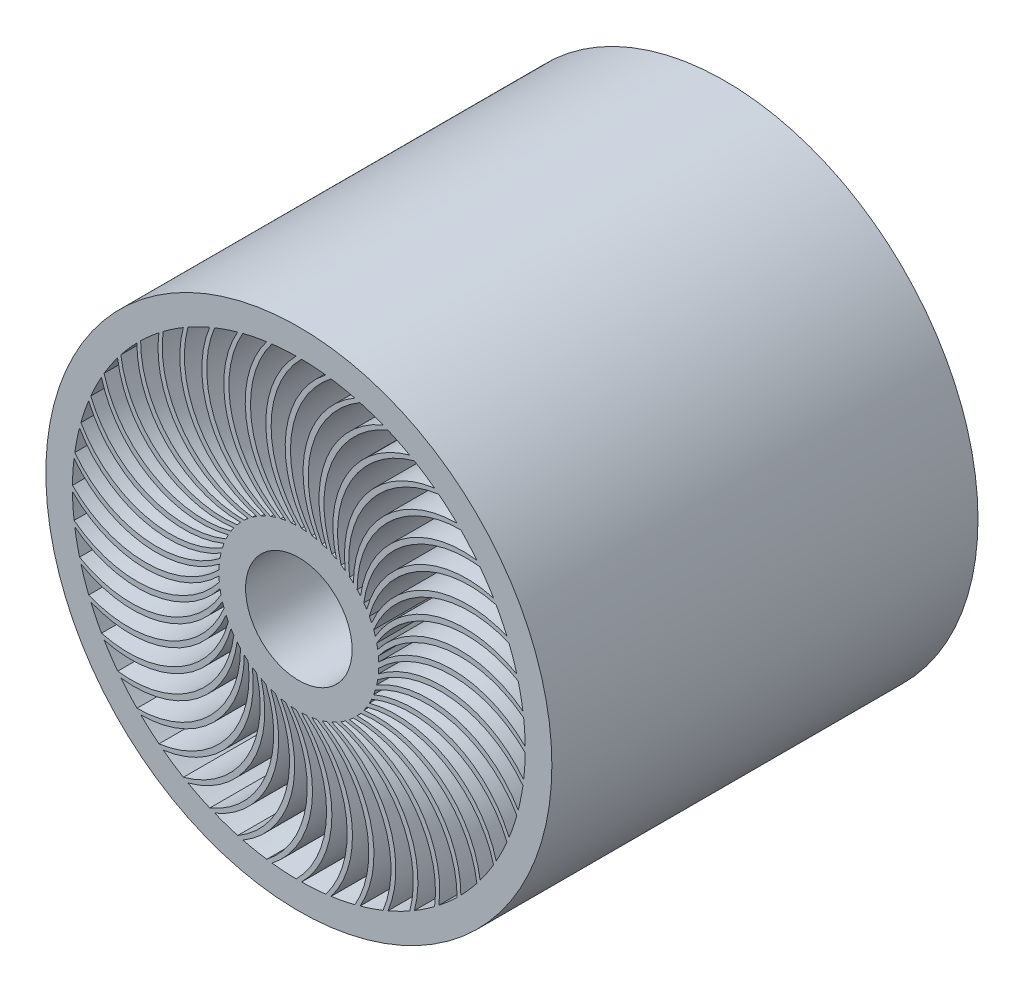
from build123d import *

# Parameters (mm, degrees)
SKETCH1_R           = 120.65
SKETCH1_R_2         = 25.4
BOSS_EXTRUDE2_DEPTH = 203.2


with BuildPart() as part:
    # Sketch1 → Boss-Extrude2 (new body)
    with BuildSketch(Plane.XY):
        Circle(SKETCH1_R)
        with BuildLine():
            ThreePointArc((1.239671441, 107.942881723), (7.029570809, 107.720878358), (12.799218379, 107.188537208))
            ThreePointArc((12.799218379, 107.188537208), (-6.095938305, 74.436927794), (3.709061895, 37.919030313))
            ThreePointArc((3.709061895, 37.919030313), (2.489766262, 38.018562098), (1.267903716, 38.078897308))
            ThreePointArc((1.267903716, 38.078897308), (-13.219615705, 73.005040764), (1.239671441, 107.942881723))
        make_face(mode=Mode.SUBTRACT)
        with BuildLine():
            ThreePointArc((-1.30119232, 107.942157652), (-15.759755454, 73.004429943), (-1.272096284, 38.078757478))
            ThreePointArc((-1.272096284, 38.078757478), (-2.493952178, 38.018287738), (-3.713236845, 37.918621707))
            ThreePointArc((-3.713236845, 37.918621707), (-22.635590043, 70.654966419), (-12.860307449, 107.181224999))
            ThreePointArc((-12.860307449, 107.181224999), (-7.090964218, 107.716854421), (-1.30119232, 107.942157652))
        make_face(mode=Mode.SUBTRACT)
        Circle(SKETCH1_R_2, mode=Mode.SUBTRACT)
        with BuildLine():
            ThreePointArc((8.626756995, 37.110498026), (7.43088411, 37.368328319), (6.227350094, 37.587632418))
            ThreePointArc((6.227350094, 37.587632418), (-3.577450076, 74.10597862), (15.318439209, 106.857605814))
            ThreePointArc((15.318439209, 106.857605814), (21.029827931, 105.8817682), (26.680630903, 104.600891175))
            ThreePointArc((26.680630903, 104.600891175), (3.672182037, 74.595789173), (8.626756995, 37.110498026))
        make_face(mode=Mode.SUBTRACT)
        with BuildLine():
            ThreePointArc((13.396845892, 35.666994829), (12.244857472, 36.078712082), (11.080244785, 36.453232717))
            ThreePointArc((11.080244785, 36.453232717), (6.125926715, 73.938942636), (29.135104234, 103.943966642))
            ThreePointArc((29.135104234, 103.943966642), (34.670258866, 102.230991632), (40.105530435, 100.223494893))
            ThreePointArc((40.105530435, 100.223494893), (13.377470327, 73.478295917), (13.396845892, 35.666994829))
        make_face(mode=Mode.SUBTRACT)
        with BuildLine():
            ThreePointArc((17.937711041, 33.613219462), (16.849317927, 34.171779079), (15.743553415, 34.695108097))
            ThreePointArc((15.743553415, 34.695108097), (15.724487202, 72.506790844), (42.453259549, 99.251817382))
            ThreePointArc((42.453259549, 99.251817382), (47.71747206, 96.831014454), (52.844213222, 94.131246826))
            ThreePointArc((52.844213222, 94.131246826), (22.853866391, 71.103568646), (17.937711041, 33.613219462))
        make_face(mode=Mode.SUBTRACT)
        with BuildLine():
            ThreePointArc((22.171656981, 30.98431259), (21.165481881, 31.680157461), (20.137485482, 32.343340558))
            ThreePointArc((20.137485482, 32.343340558), (25.053997353, 69.834027758), (55.045027822, 92.861442009))
            ThreePointArc((55.045027822, 92.861442009), (59.948226077, 89.774231772), (64.678716869, 86.428387027))
            ThreePointArc((64.678716869, 86.428387027), (31.939226465, 67.512239602), (22.171656981, 30.984312591))
        make_face(mode=Mode.SUBTRACT)
        with BuildLine():
            ThreePointArc((26.026239723, 27.82525554), (25.119498571, 28.646479566), (24.186859589, 29.438169495))
            ThreePointArc((24.186859589, 29.438169495), (33.954826663, 65.966385095), (66.694960408, 84.882181618))
            ThreePointArc((66.694960408, 84.882181618), (71.153249325, 81.181387094), (75.406549739, 77.246713565))
            ThreePointArc((75.406549739, 77.246713565), (40.478097518, 62.76575742), (26.026239723, 27.82525554))
        make_face(mode=Mode.SUBTRACT)
        with BuildLine():
            ThreePointArc((29.435506288, 24.190100653), (28.643713677, 25.122652463), (27.822389822, 26.029303191))
            ThreePointArc((27.822389822, 26.029303191), (42.274679475, 60.970039294), (77.20372373, 75.450563565))
            ThreePointArc((77.20372373, 75.450563565), (81.14082075, 71.199506375), (84.844155635, 66.743327416))
            ThreePointArc((84.844155635, 66.743327416), (48.3243771, 56.945335727), (29.435506288, 24.190100653))
        make_face(mode=Mode.SUBTRACT)
        with BuildLine():
            ThreePointArc((32.341123178, 20.141046436), (31.6778269, 21.168969811), (30.981871252, 22.175068291))
            ThreePointArc((30.981871252, 22.175068291), (49.871200801, 54.930479217), (86.391509934, 64.727965451))
            ThreePointArc((86.391509934, 64.727965451), (89.740050235, 59.999382361), (92.830054506, 55.09794443))
            ThreePointArc((92.830054506, 55.09794443), (55.343813192, 50.150563552), (32.341123178, 20.141046436))
        make_face(mode=Mode.SUBTRACT)
        with BuildLine():
            ThreePointArc((34.693374485, 15.747373332), (34.169923723, 16.853080217), (33.611244275, 17.941411826))
            ThreePointArc((33.611244275, 17.941411826), (56.614412053, 47.95104341), (94.101113451, 52.897853901))
            ThreePointArc((94.101113451, 52.897853901), (96.803802581, 47.772652281), (99.227605407, 42.509820339))
            ThreePointArc((99.227605407, 42.509820339), (61.416301297, 42.497701329), (34.693374485, 15.747373332))
        make_face(mode=Mode.SUBTRACT)
        with BuildLine():
            ThreePointArc((36.452012535, 11.084258303), (36.077363676, 12.248829747), (35.665519589, 13.40077283))
            ThreePointArc((35.665519589, 13.40077283), (62.388935019, 40.151151957), (100.200620826, 40.162645406))
            ThreePointArc((100.200620826, 40.162645406), (102.211215024, 34.728518875), (103.927344468, 29.194341436))
            ThreePointArc((103.927344468, 29.194341436), (66.437939458, 34.117691655), (36.452012535, 11.084258303))
        make_face(mode=Mode.SUBTRACT)
        with BuildLine():
            ThreePointArc((37.586946545, 6.231488542), (37.367509935, 7.434998405), (37.109547975, 8.630842895))
            ThreePointArc((37.109547975, 8.630842895), (67.09596601, 31.664263161), (104.585667799, 26.740242912))
            ThreePointArc((104.585667799, 26.740242912), (105.869765241, 21.090170882), (106.848857851, 15.379339257))
            ThreePointArc((106.848857851, 15.379339257), (70.322806055, 25.153918817), (37.586946545, 6.231488542))
        make_face(mode=Mode.SUBTRACT)
        with BuildLine():
            ThreePointArc((38.078757478, 1.272096284), (38.018287738, 2.493952178), (37.918621707, 3.713236845))
            ThreePointArc((37.918621707, 3.713236845), (70.654966419, 22.635590043), (107.181224999, 12.860307449))
            ThreePointArc((107.181224999, 12.860307449), (107.716854421, 7.090964218), (107.942157652, 1.30119232))
            ThreePointArc((107.942157652, 1.30119232), (73.004429943, 15.759755454), (38.078757478, 1.272096284))
        make_face(mode=Mode.SUBTRACT)
        with BuildLine():
            ThreePointArc((37.919030313, -3.709061895), (38.018562098, -2.489766262), (38.078897308, -1.267903716))
            ThreePointArc((38.078897308, -1.267903716), (73.005040764, 13.219615705), (107.942881723, -1.239671441))
            ThreePointArc((107.942881723, -1.239671441), (107.720878358, -7.029570809), (107.188537208, -12.799218379))
            ThreePointArc((107.188537208, -12.799218379), (74.436927794, 6.095938305), (37.919030313, -3.709061895))
        make_face(mode=Mode.SUBTRACT)
        with BuildLine():
            ThreePointArc((37.110498026, -8.626756995), (37.368328319, -7.43088411), (37.587632418, -6.227350094))
            ThreePointArc((37.587632418, -6.227350094), (74.10597862, 3.577450076), (106.857605814, -15.318439209))
            ThreePointArc((106.857605814, -15.318439209), (105.8817682, -21.029827931), (104.600891175, -26.680630903))
            ThreePointArc((104.600891175, -26.680630903), (74.595789173, -3.672182037), (37.110498026, -8.626756995))
        make_face(mode=Mode.SUBTRACT)
        with BuildLine():
            ThreePointArc((35.666994829, -13.396845892), (36.078712082, -12.244857472), (36.453232717, -11.080244785))
            ThreePointArc((36.453232717, -11.080244785), (73.938942636, -6.125926715), (103.943966642, -29.135104234))
            ThreePointArc((103.943966642, -29.135104234), (102.230991632, -34.670258866), (100.223494893, -40.105530435))
            ThreePointArc((100.223494893, -40.105530435), (73.478295917, -13.377470327), (35.666994829, -13.396845892))
        make_face(mode=Mode.SUBTRACT)
        with BuildLine():
            ThreePointArc((33.613219462, -17.937711041), (34.171779079, -16.849317927), (34.695108097, -15.743553415))
            ThreePointArc((34.695108097, -15.743553415), (72.506790844, -15.724487202), (99.251817382, -42.453259549))
            ThreePointArc((99.251817382, -42.453259549), (96.831014454, -47.71747206), (94.131246826, -52.844213222))
            ThreePointArc((94.131246826, -52.844213222), (71.103568646, -22.853866391), (33.613219462, -17.937711041))
        make_face(mode=Mode.SUBTRACT)
        with BuildLine():
            ThreePointArc((30.984312591, -22.171656981), (31.680157461, -21.165481881), (32.343340558, -20.137485482))
            ThreePointArc((32.343340558, -20.137485482), (69.834027758, -25.053997353), (92.861442009, -55.045027822))
            ThreePointArc((92.861442009, -55.045027822), (89.774231772, -59.948226077), (86.428387027, -64.678716869))
            ThreePointArc((86.428387027, -64.678716869), (67.512239602, -31.939226465), (30.984312591, -22.171656981))
        make_face(mode=Mode.SUBTRACT)
        with BuildLine():
            ThreePointArc((27.82525554, -26.026239723), (28.646479566, -25.119498571), (29.438169495, -24.186859589))
            ThreePointArc((29.438169495, -24.186859589), (65.966385095, -33.954826663), (84.882181618, -66.694960408))
            ThreePointArc((84.882181618, -66.694960408), (81.181387094, -71.153249325), (77.246713565, -75.406549739))
            ThreePointArc((77.246713565, -75.406549739), (62.76575742, -40.478097518), (27.82525554, -26.026239723))
        make_face(mode=Mode.SUBTRACT)
        with BuildLine():
            ThreePointArc((24.190100653, -29.435506288), (25.122652463, -28.643713677), (26.029303191, -27.822389822))
            ThreePointArc((26.029303191, -27.822389822), (60.970039294, -42.274679475), (75.450563565, -77.20372373))
            ThreePointArc((75.450563565, -77.20372373), (71.199506375, -81.14082075), (66.743327416, -84.844155635))
            ThreePointArc((66.743327416, -84.844155635), (56.945335727, -48.3243771), (24.190100653, -29.435506288))
        make_face(mode=Mode.SUBTRACT)
        with BuildLine():
            ThreePointArc((20.141046436, -32.341123178), (21.168969811, -31.6778269), (22.175068291, -30.981871252))
            ThreePointArc((22.175068291, -30.981871252), (54.930479217, -49.871200801), (64.727965451, -86.391509934))
            ThreePointArc((64.727965451, -86.391509934), (59.999382361, -89.740050235), (55.09794443, -92.830054506))
            ThreePointArc((55.09794443, -92.830054506), (50.150563552, -55.343813192), (20.141046436, -32.341123178))
        make_face(mode=Mode.SUBTRACT)
        with BuildLine():
            ThreePointArc((15.747373332, -34.693374485), (16.853080217, -34.169923723), (17.941411826, -33.611244275))
            ThreePointArc((17.941411826, -33.611244275), (47.95104341, -56.614412053), (52.897853901, -94.101113451))
            ThreePointArc((52.897853901, -94.101113451), (47.772652281, -96.803802581), (42.509820339, -99.227605407))
            ThreePointArc((42.509820339, -99.227605407), (42.497701329, -61.416301297), (15.747373332, -34.693374485))
        make_face(mode=Mode.SUBTRACT)
        with BuildLine():
            ThreePointArc((11.084258303, -36.452012535), (12.248829747, -36.077363676), (13.40077283, -35.665519589))
            ThreePointArc((13.40077283, -35.665519589), (40.151151957, -62.388935019), (40.162645406, -100.200620826))
            ThreePointArc((40.162645406, -100.200620826), (34.728518875, -102.211215024), (29.194341436, -103.927344468))
            ThreePointArc((29.194341436, -103.927344468), (34.117691655, -66.437939458), (11.084258303, -36.452012535))
        make_face(mode=Mode.SUBTRACT)
        with BuildLine():
            ThreePointArc((6.231488542, -37.586946545), (7.434998405, -37.367509935), (8.630842895, -37.109547975))
            ThreePointArc((8.630842895, -37.109547975), (31.664263161, -67.09596601), (26.740242912, -104.585667799))
            ThreePointArc((26.740242912, -104.585667799), (21.090170882, -105.869765241), (15.379339257, -106.848857851))
            ThreePointArc((15.379339257, -106.848857851), (25.153918817, -70.322806055), (6.231488542, -37.586946545))
        make_face(mode=Mode.SUBTRACT)
        with BuildLine():
            ThreePointArc((1.272096284, -38.078757478), (2.493952178, -38.018287738), (3.713236845, -37.918621707))
            ThreePointArc((3.713236845, -37.918621707), (22.635590043, -70.654966419), (12.860307449, -107.181224999))
            ThreePointArc((12.860307449, -107.181224999), (7.090964218, -107.716854421), (1.30119232, -107.942157652))
            ThreePointArc((1.30119232, -107.942157652), (15.759755454, -73.004429943), (1.272096284, -38.078757478))
        make_face(mode=Mode.SUBTRACT)
        with BuildLine():
            ThreePointArc((-3.709061894, -37.919030313), (-2.489766262, -38.018562098), (-1.267903716, -38.078897308))
            ThreePointArc((-1.267903716, -38.078897308), (13.219615705, -73.005040764), (-1.239671441, -107.942881723))
            ThreePointArc((-1.239671441, -107.942881723), (-7.029570809, -107.720878358), (-12.799218379, -107.188537208))
            ThreePointArc((-12.799218379, -107.188537208), (6.095938305, -74.436927794), (-3.709061894, -37.919030313))
        make_face(mode=Mode.SUBTRACT)
        with BuildLine():
            ThreePointArc((-8.626756995, -37.110498026), (-7.43088411, -37.368328319), (-6.227350094, -37.587632418))
            ThreePointArc((-6.227350094, -37.587632418), (3.577450076, -74.10597862), (-15.318439209, -106.857605814))
            ThreePointArc((-15.318439209, -106.857605814), (-21.029827931, -105.8817682), (-26.680630903, -104.600891175))
            ThreePointArc((-26.680630903, -104.600891175), (-3.672182037, -74.595789173), (-8.626756995, -37.110498026))
        make_face(mode=Mode.SUBTRACT)
        with BuildLine():
            ThreePointArc((-13.396845892, -35.666994829), (-12.244857472, -36.078712082), (-11.080244785, -36.453232717))
            ThreePointArc((-11.080244785, -36.453232717), (-6.125926715, -73.938942636), (-29.135104234, -103.943966642))
            ThreePointArc((-29.135104234, -103.943966642), (-34.670258866, -102.230991632), (-40.105530435, -100.223494893))
            ThreePointArc((-40.105530435, -100.223494893), (-13.377470327, -73.478295917), (-13.396845892, -35.666994829))
        make_face(mode=Mode.SUBTRACT)
        with BuildLine():
            ThreePointArc((-17.937711041, -33.613219462), (-16.849317927, -34.171779079), (-15.743553415, -34.695108097))
            ThreePointArc((-15.743553415, -34.695108097), (-15.724487202, -72.506790844), (-42.453259549, -99.251817382))
            ThreePointArc((-42.453259549, -99.251817382), (-47.71747206, -96.831014454), (-52.844213222, -94.131246826))
            ThreePointArc((-52.844213222, -94.131246826), (-22.853866391, -71.103568646), (-17.937711041, -33.613219462))
        make_face(mode=Mode.SUBTRACT)
        with BuildLine():
            ThreePointArc((-22.171656981, -30.984312591), (-21.165481881, -31.680157461), (-20.137485482, -32.343340558))
            ThreePointArc((-20.137485482, -32.343340558), (-25.053997353, -69.834027758), (-55.045027822, -92.861442009))
            ThreePointArc((-55.045027822, -92.861442009), (-59.948226077, -89.774231772), (-64.678716869, -86.428387027))
            ThreePointArc((-64.678716869, -86.428387027), (-31.939226465, -67.512239602), (-22.171656981, -30.984312591))
        make_face(mode=Mode.SUBTRACT)
        with BuildLine():
            ThreePointArc((-26.026239723, -27.82525554), (-25.119498571, -28.646479566), (-24.186859589, -29.438169495))
            ThreePointArc((-24.186859589, -29.438169495), (-33.954826663, -65.966385095), (-66.694960408, -84.882181618))
            ThreePointArc((-66.694960408, -84.882181618), (-71.153249325, -81.181387094), (-75.406549739, -77.246713565))
            ThreePointArc((-75.406549739, -77.246713565), (-40.478097518, -62.76575742), (-26.026239723, -27.82525554))
        make_face(mode=Mode.SUBTRACT)
        with BuildLine():
            ThreePointArc((-29.435506288, -24.190100653), (-28.643713677, -25.122652463), (-27.822389822, -26.029303191))
            ThreePointArc((-27.822389822, -26.029303191), (-42.274679475, -60.970039294), (-77.20372373, -75.450563565))
            ThreePointArc((-77.20372373, -75.450563565), (-81.14082075, -71.199506375), (-84.844155635, -66.743327416))
            ThreePointArc((-84.844155635, -66.743327416), (-48.3243771, -56.945335727), (-29.435506288, -24.190100653))
        make_face(mode=Mode.SUBTRACT)
        with BuildLine():
            ThreePointArc((-32.341123178, -20.141046436), (-31.6778269, -21.168969811), (-30.981871252, -22.175068291))
            ThreePointArc((-30.981871252, -22.175068291), (-49.871200801, -54.930479217), (-86.391509934, -64.727965451))
            ThreePointArc((-86.391509934, -64.727965451), (-89.740050235, -59.999382361), (-92.830054506, -55.09794443))
            ThreePointArc((-92.830054506, -55.09794443), (-55.343813192, -50.150563552), (-32.341123178, -20.141046436))
        make_face(mode=Mode.SUBTRACT)
        with BuildLine():
            ThreePointArc((-34.693374485, -15.747373332), (-34.169923723, -16.853080217), (-33.611244275, -17.941411826))
            ThreePointArc((-33.611244275, -17.941411826), (-56.614412053, -47.95104341), (-94.101113451, -52.897853901))
            ThreePointArc((-94.101113451, -52.897853901), (-96.803802581, -47.772652281), (-99.227605407, -42.509820339))
            ThreePointArc((-99.227605407, -42.509820339), (-61.416301297, -42.497701329), (-34.693374485, -15.747373332))
        make_face(mode=Mode.SUBTRACT)
        with BuildLine():
            ThreePointArc((-36.452012535, -11.084258303), (-36.077363676, -12.248829747), (-35.665519589, -13.40077283))
            ThreePointArc((-35.665519589, -13.40077283), (-62.388935019, -40.151151957), (-100.200620826, -40.162645406))
            ThreePointArc((-100.200620826, -40.162645406), (-102.211215024, -34.728518875), (-103.927344468, -29.194341436))
            ThreePointArc((-103.927344468, -29.194341436), (-66.437939458, -34.117691655), (-36.452012535, -11.084258303))
        make_face(mode=Mode.SUBTRACT)
        with BuildLine():
            ThreePointArc((-37.586946545, -6.231488542), (-37.367509935, -7.434998405), (-37.109547975, -8.630842895))
            ThreePointArc((-37.109547975, -8.630842895), (-67.09596601, -31.664263161), (-104.585667799, -26.740242912))
            ThreePointArc((-104.585667799, -26.740242912), (-105.869765241, -21.090170882), (-106.848857851, -15.379339257))
            ThreePointArc((-106.848857851, -15.379339257), (-70.322806055, -25.153918817), (-37.586946545, -6.231488542))
        make_face(mode=Mode.SUBTRACT)
        with BuildLine():
            ThreePointArc((-38.078757478, -1.272096284), (-38.018287738, -2.493952178), (-37.918621707, -3.713236845))
            ThreePointArc((-37.918621707, -3.713236845), (-70.654966419, -22.635590043), (-107.181224999, -12.860307449))
            ThreePointArc((-107.181224999, -12.860307449), (-107.716854421, -7.090964218), (-107.942157652, -1.30119232))
            ThreePointArc((-107.942157652, -1.30119232), (-73.004429943, -15.759755454), (-38.078757478, -1.272096284))
        make_face(mode=Mode.SUBTRACT)
        with BuildLine():
            ThreePointArc((-37.919030313, 3.709061895), (-38.018562098, 2.489766262), (-38.078897308, 1.267903716))
            ThreePointArc((-38.078897308, 1.267903716), (-73.005040764, -13.219615705), (-107.942881723, 1.239671441))
            ThreePointArc((-107.942881723, 1.239671441), (-107.720878358, 7.029570809), (-107.188537208, 12.799218379))
            ThreePointArc((-107.188537208, 12.799218379), (-74.436927794, -6.095938305), (-37.919030313, 3.709061895))
        make_face(mode=Mode.SUBTRACT)
        with BuildLine():
            ThreePointArc((-37.110498026, 8.626756995), (-37.368328319, 7.43088411), (-37.587632418, 6.227350094))
            ThreePointArc((-37.587632418, 6.227350094), (-74.10597862, -3.577450076), (-106.857605814, 15.318439209))
            ThreePointArc((-106.857605814, 15.318439209), (-105.8817682, 21.029827931), (-104.600891175, 26.680630903))
            ThreePointArc((-104.600891175, 26.680630903), (-74.595789173, 3.672182037), (-37.110498026, 8.626756995))
        make_face(mode=Mode.SUBTRACT)
        with BuildLine():
            ThreePointArc((-35.666994829, 13.396845892), (-36.078712082, 12.244857472), (-36.453232717, 11.080244785))
            ThreePointArc((-36.453232717, 11.080244785), (-73.938942636, 6.125926715), (-103.943966642, 29.135104234))
            ThreePointArc((-103.943966642, 29.135104234), (-102.230991632, 34.670258866), (-100.223494893, 40.105530435))
            ThreePointArc((-100.223494893, 40.105530435), (-73.478295917, 13.377470327), (-35.666994829, 13.396845892))
        make_face(mode=Mode.SUBTRACT)
        with BuildLine():
            ThreePointArc((-33.613219462, 17.937711041), (-34.171779079, 16.849317927), (-34.695108097, 15.743553415))
            ThreePointArc((-34.695108097, 15.743553415), (-72.506790844, 15.724487202), (-99.251817382, 42.453259549))
            ThreePointArc((-99.251817382, 42.453259549), (-96.831014454, 47.71747206), (-94.131246826, 52.844213222))
            ThreePointArc((-94.131246826, 52.844213222), (-71.103568646, 22.853866391), (-33.613219462, 17.937711041))
        make_face(mode=Mode.SUBTRACT)
        with BuildLine():
            ThreePointArc((-30.984312591, 22.171656981), (-31.680157461, 21.165481881), (-32.343340558, 20.137485482))
            ThreePointArc((-32.343340558, 20.137485482), (-69.834027758, 25.053997353), (-92.861442009, 55.045027822))
            ThreePointArc((-92.861442009, 55.045027822), (-89.774231772, 59.948226077), (-86.428387027, 64.678716869))
            ThreePointArc((-86.428387027, 64.678716869), (-67.512239602, 31.939226465), (-30.98431259, 22.171656981))
        make_face(mode=Mode.SUBTRACT)
        with BuildLine():
            ThreePointArc((-27.82525554, 26.026239723), (-28.646479566, 25.119498571), (-29.438169495, 24.186859589))
            ThreePointArc((-29.438169495, 24.186859589), (-65.966385095, 33.954826663), (-84.882181618, 66.694960408))
            ThreePointArc((-84.882181618, 66.694960408), (-81.181387094, 71.153249325), (-77.246713565, 75.406549739))
            ThreePointArc((-77.246713564, 75.406549739), (-62.76575742, 40.478097518), (-27.82525554, 26.026239723))
        make_face(mode=Mode.SUBTRACT)
        with BuildLine():
            ThreePointArc((-24.190100653, 29.435506288), (-25.122652463, 28.643713677), (-26.029303191, 27.822389822))
            ThreePointArc((-26.029303191, 27.822389822), (-60.970039294, 42.274679475), (-75.450563565, 77.20372373))
            ThreePointArc((-75.450563565, 77.20372373), (-71.199506375, 81.14082075), (-66.743327416, 84.844155635))
            ThreePointArc((-66.743327416, 84.844155635), (-56.945335727, 48.3243771), (-24.190100653, 29.435506288))
        make_face(mode=Mode.SUBTRACT)
        with BuildLine():
            ThreePointArc((-20.141046436, 32.341123178), (-21.168969811, 31.6778269), (-22.175068291, 30.981871252))
            ThreePointArc((-22.175068291, 30.981871252), (-54.930479217, 49.871200801), (-64.727965451, 86.391509934))
            ThreePointArc((-64.727965451, 86.391509934), (-59.999382361, 89.740050236), (-55.09794443, 92.830054506))
            ThreePointArc((-55.09794443, 92.830054506), (-50.150563552, 55.343813192), (-20.141046436, 32.341123178))
        make_face(mode=Mode.SUBTRACT)
        with BuildLine():
            ThreePointArc((-15.747373332, 34.693374485), (-16.853080217, 34.169923723), (-17.941411826, 33.611244275))
            ThreePointArc((-17.941411826, 33.611244275), (-47.95104341, 56.614412053), (-52.897853901, 94.101113451))
            ThreePointArc((-52.897853901, 94.101113451), (-47.772652281, 96.803802581), (-42.509820339, 99.227605407))
            ThreePointArc((-42.509820339, 99.227605407), (-42.497701329, 61.416301297), (-15.747373332, 34.693374485))
        make_face(mode=Mode.SUBTRACT)
        with BuildLine():
            ThreePointArc((-11.084258303, 36.452012535), (-12.248829747, 36.077363676), (-13.40077283, 35.665519589))
            ThreePointArc((-13.40077283, 35.665519589), (-40.151151957, 62.388935019), (-40.162645406, 100.200620826))
            ThreePointArc((-40.162645406, 100.200620826), (-34.728518875, 102.211215024), (-29.194341436, 103.927344468))
            ThreePointArc((-29.194341436, 103.927344468), (-34.117691655, 66.437939458), (-11.084258303, 36.452012535))
        make_face(mode=Mode.SUBTRACT)
        with BuildLine():
            ThreePointArc((-6.231488542, 37.586946545), (-7.434998405, 37.367509935), (-8.630842895, 37.109547975))
            ThreePointArc((-8.630842895, 37.109547975), (-31.664263161, 67.09596601), (-26.740242912, 104.585667799))
            ThreePointArc((-26.740242912, 104.585667799), (-21.090170882, 105.869765241), (-15.379339257, 106.848857851))
            ThreePointArc((-15.379339257, 106.848857851), (-25.153918817, 70.322806055), (-6.231488542, 37.586946545))
        make_face(mode=Mode.SUBTRACT)
    extrude(amount=BOSS_EXTRUDE2_DEPTH)


solid = part.part
